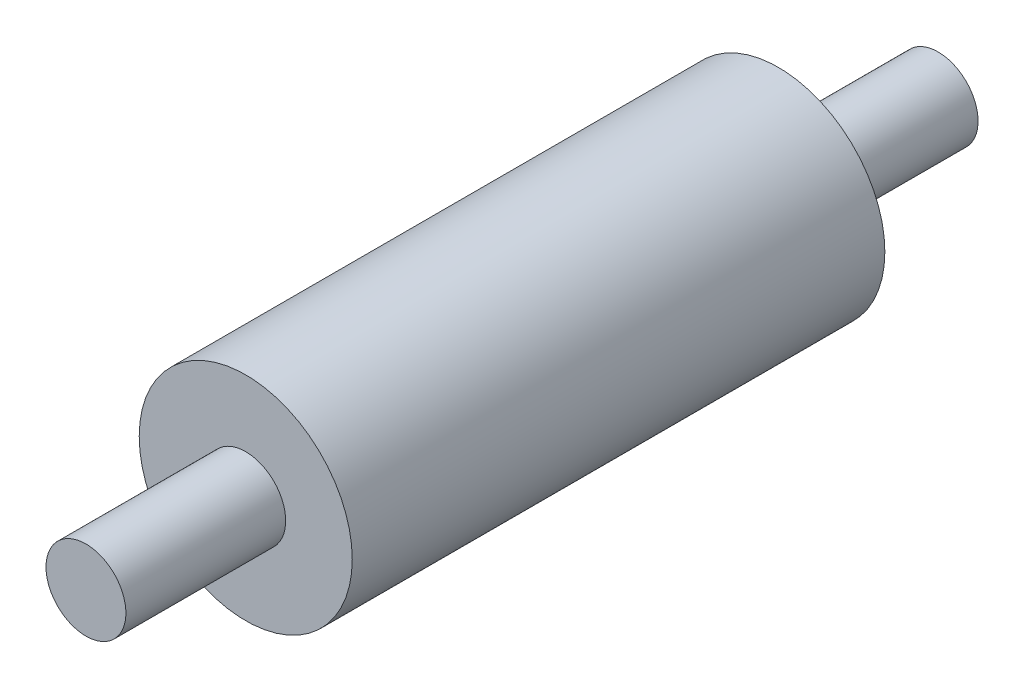
from build123d import *

# Parameters (mm, degrees)
SKETCH1_R           = 20
BOSS_EXTRUDE1_DEPTH = 100
SKETCH2_R           = 7.5
BOSS_EXTRUDE2_DEPTH = 30
LPATTERN1_COUNT     = 2
LPATTERN1_PITCH     = 130


with BuildPart() as part:
    # Sketch1 → Boss-Extrude1 (new body)
    with BuildSketch(Plane.XY):
        Circle(SKETCH1_R)
    extrude(amount=BOSS_EXTRUDE1_DEPTH)

    # Sketch2 → Boss-Extrude2 (add)
    with BuildSketch(Plane.XY.offset(100)):
        Circle(SKETCH2_R)
    boss_extrude2 = extrude(amount=BOSS_EXTRUDE2_DEPTH)

    # LPattern1: Boss-Extrude2 ×2
    with Locations(*[(0, 0, -i * LPATTERN1_PITCH) for i in range(1, LPATTERN1_COUNT)]):
        add(boss_extrude2)


solid = part.part
